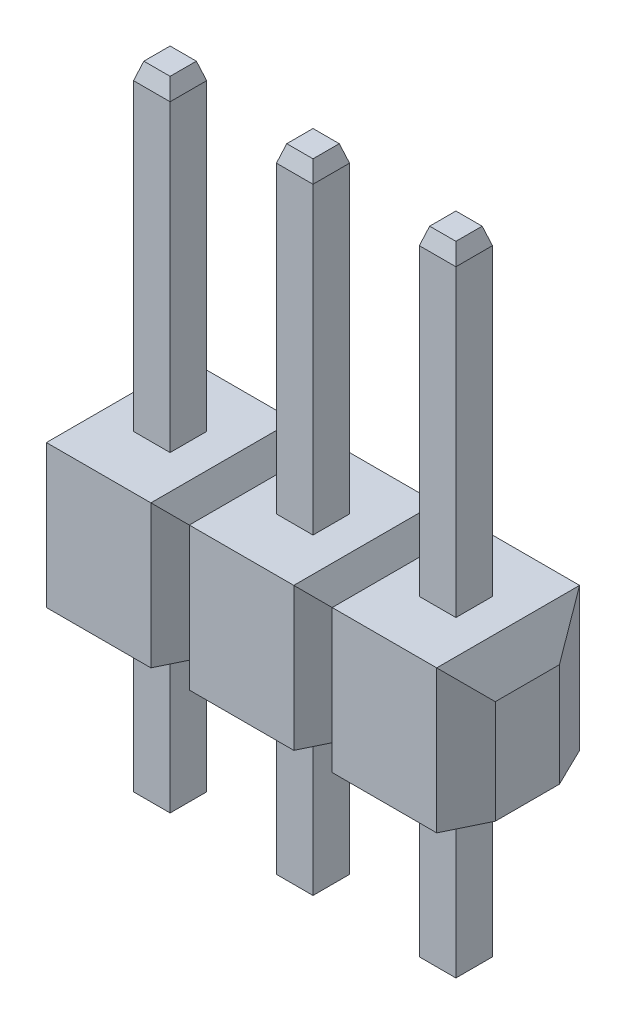
from build123d import *
from OCP.BRepFilletAPI import BRepFilletAPI_MakeChamfer

# Parameters (mm, degrees)
SKETCH1_W                    = 2.54
SKETCH1_H                    = 2.54
BOSS_EXTRUDE1_DEPTH          = 2.54
BOSS_EXTRUDE2_START          = -5.64
SKETCH2_W                    = 0.65
SKETCH2_H                    = 0.65
BOSS_EXTRUDE2_DEPTH          = 11.34
CHAMFER1_SIZE                = 0.3
CHAMFER1_SIZE2               = 0.091719204
CHAMFER3_SIZE                = 0.7
CHAMFER3_SIZE2               = 0.341412812
CHAMFER4_SIZE                = 0.7
CHAMFER4_SIZE2               = 0.341412812
R_P_TITION_START             = -1.27
R_P_TITION_LIN_AIRE3_DEPTH   = 2.54
R_P_TITION_START_2           = -0.325
R_P_TITION_LIN_AIRE3_2_DEPTH = 0.65
R_P_TITION_START_3           = 1.611412812
R_P_TITION_LIN_AIRE3_3_DEPTH = 4.397174376
R_P_TITION_START_4           = -1
R_P_TITION_LIN_AIRE3_4_DEPTH = 5


with BuildPart() as part:
    # Sketch1 → Boss-Extrude1 (new body)
    with BuildSketch(Plane(origin=(0, 0, 0), x_dir=(1, 0, 0), z_dir=(0, 1, 0))):
        Rectangle(SKETCH1_W, SKETCH1_H)
    extrude(amount=BOSS_EXTRUDE1_DEPTH)

    # Sketch2 → Boss-Extrude2 (add)
    with BuildSketch(Plane(origin=(0, 2.54, 0), x_dir=(1, 0, 0), z_dir=(0, 1, 0)).offset(BOSS_EXTRUDE2_START)):
        Rectangle(SKETCH2_W, SKETCH2_H)
    extrude(amount=BOSS_EXTRUDE2_DEPTH)

    # Chamfer1: one chamfer whose edges measure the first distance from different faces: ONE call of the kernel's chamfer builder (chamfer() names one face for all edges)
    chamfer1_edges_1 = [part.edges().sort_by_distance(p)[0] for p in [
        (-0.325, -3.1, 0),
        (0, -3.1, -0.325),
        (0.325, -3.1, 0),
        (0, -3.1, 0.325),
    ]]
    chamfer1_side_1 = [part.faces().sort_by_distance(p)[0] for p in [
        (0, -3.1, 0),
    ]]
    chamfer1_edges_2 = [part.edges().sort_by_distance(p)[0] for p in [
        (-0.325, 8.24, 0),
    ]]
    chamfer1_side_2 = [part.faces().sort_by_distance(p)[0] for p in [
        (-0.325, 5.39, 0),
    ]]
    chamfer1_edges_3 = [part.edges().sort_by_distance(p)[0] for p in [
        (0, 8.24, 0.325),
    ]]
    chamfer1_side_3 = [part.faces().sort_by_distance(p)[0] for p in [
        (0, 5.39, 0.325),
    ]]
    chamfer1_edges_4 = [part.edges().sort_by_distance(p)[0] for p in [
        (0.325, 8.24, 0),
    ]]
    chamfer1_side_4 = [part.faces().sort_by_distance(p)[0] for p in [
        (0.325, 5.39, 0),
    ]]
    chamfer1_edges_5 = [part.edges().sort_by_distance(p)[0] for p in [
        (0, 8.24, -0.325),
    ]]
    chamfer1_side_5 = [part.faces().sort_by_distance(p)[0] for p in [
        (0, 5.39, -0.325),
    ]]
    chamfer1 = BRepFilletAPI_MakeChamfer(part.part.solid().wrapped)
    for e in chamfer1_edges_1:
        chamfer1.Add(CHAMFER1_SIZE, CHAMFER1_SIZE2, e.wrapped, chamfer1_side_1[0].wrapped)  # the first distance lies on this face
    for e in chamfer1_edges_2:
        chamfer1.Add(CHAMFER1_SIZE, CHAMFER1_SIZE2, e.wrapped, chamfer1_side_2[0].wrapped)  # the first distance lies on this face
    for e in chamfer1_edges_3:
        chamfer1.Add(CHAMFER1_SIZE, CHAMFER1_SIZE2, e.wrapped, chamfer1_side_3[0].wrapped)  # the first distance lies on this face
    for e in chamfer1_edges_4:
        chamfer1.Add(CHAMFER1_SIZE, CHAMFER1_SIZE2, e.wrapped, chamfer1_side_4[0].wrapped)  # the first distance lies on this face
    for e in chamfer1_edges_5:
        chamfer1.Add(CHAMFER1_SIZE, CHAMFER1_SIZE2, e.wrapped, chamfer1_side_5[0].wrapped)  # the first distance lies on this face
    add(Compound.cast(chamfer1.Shape()), mode=Mode.REPLACE)

    # Chamfer3
    chamfer3_edges = [part.edges().sort_by_distance(p)[0] for p in [
        (1.27, 2.54, 0),
        (1.27, 1.27, 1.27),
        (1.27, 1.27, -1.27),
    ]]
    chamfer3_side = [part.faces().sort_by_distance(p)[0] for p in [
        (1.27, 1.27, 0),
    ]]
    chamfer(chamfer3_edges, length=CHAMFER3_SIZE, length2=CHAMFER3_SIZE2, reference=chamfer3_side[0])

    # Chamfer4
    chamfer4_edges = [part.edges().sort_by_distance(p)[0] for p in [
        (-1.27, 2.54, 0),
        (-1.27, 1.27, 1.27),
        (-1.27, 1.27, -1.27),
    ]]
    chamfer4_side = [part.faces().sort_by_distance(p)[0] for p in [
        (-1.27, 1.27, 0),
    ]]
    chamfer(chamfer4_edges, length=CHAMFER4_SIZE, length2=CHAMFER4_SIZE2, reference=chamfer4_side[0])

    # Répétition linéaire3: read off the stored shape, not the designer's step
    # Répétition linéaire3 outline → Répétition linéaire3 (add)
    with BuildSketch(Plane.XY.offset(R_P_TITION_START)):
        Polygon((3.468587188, 2.54), (1.611412812, 2.54), (1.27, 1.84), (1.27, 0), (6.35, 0), (6.35, 1.84), (6.008587188, 2.54), (4.151412812, 2.54), (3.81, 1.84), align=None)
    extrude(amount=R_P_TITION_LIN_AIRE3_DEPTH)

    # R_p_tition lin_aire3 2 outline → R_p_tition lin_aire3 2 (add)
    with BuildSketch(Plane.XY.offset(R_P_TITION_START_2)):
        Polygon((2.215, 7.94), (2.215, 2.54), (2.865, 2.54), (2.865, 7.94), (2.773280796, 8.24), (2.306719204, 8.24), align=None)
        Polygon((2.865, 0), (2.215, 0), (2.215, -3.008280796), (2.515, -3.1), (2.565, -3.1), (2.865, -3.008280796), align=None)
        Polygon((5.405, 0), (4.755, 0), (4.755, -3.008280796), (5.055, -3.1), (5.105, -3.1), (5.405, -3.008280796), align=None)
        Polygon((4.755, 7.94), (4.755, 2.54), (5.405, 2.54), (5.405, 7.94), (5.313280796, 8.24), (4.846719204, 8.24), align=None)
    extrude(amount=R_P_TITION_LIN_AIRE3_2_DEPTH)

    # R_p_tition lin_aire3 3 outline → R_p_tition lin_aire3 3 (cut)
    with BuildSketch(Plane.YZ.offset(R_P_TITION_START_3)):
        Polygon((-3.1, 0.025), (-3.008280796, 0.325), (-3.1, 0.325), align=None)
        Polygon((-3.008280796, -0.325), (-3.1, -0.025), (-3.1, -0.325), align=None)
        Polygon((8.24, 0.325), (7.94, 0.325), (8.24, 0.233280796), align=None)
        Polygon((8.24, -0.325), (8.24, -0.233280796), (7.94, -0.325), align=None)
    extrude(amount=R_P_TITION_LIN_AIRE3_3_DEPTH, mode=Mode.SUBTRACT)

    # R_p_tition lin_aire3 4 outline → R_p_tition lin_aire3 4 (cut)
    with BuildSketch(Plane(origin=(0, 0, 0), x_dir=(1, 0, 0), z_dir=(0, 1, 0)).offset(R_P_TITION_START_4)):
        Polygon((4.151412812, -1.27), (3.81, -0.57), (3.468587188, -1.27), align=None)
        Polygon((1.27, 0.57), (1.611412812, 1.27), (1.27, 1.27), align=None)
        Polygon((3.81, 0.57), (4.151412812, 1.27), (3.468587188, 1.27), align=None)
        Polygon((6.008587188, 1.27), (6.35, 0.57), (6.35, 1.27), align=None)
        Polygon((6.35, -0.57), (6.008587188, -1.27), (6.35, -1.27), align=None)
        Polygon((1.27, -1.27), (1.611412812, -1.27), (1.27, -0.57), align=None)
    extrude(amount=R_P_TITION_LIN_AIRE3_4_DEPTH, mode=Mode.SUBTRACT)


solid = part.part
